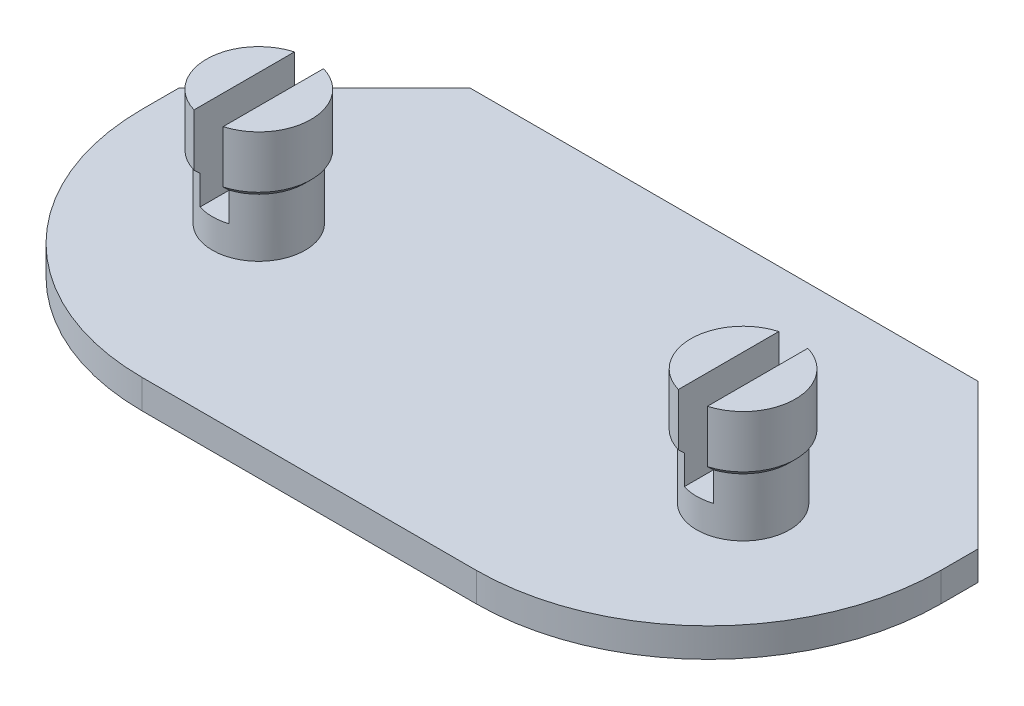
from build123d import *

# Parameters (mm, degrees)
SKETCH2_W               = 55
SKETCH2_H               = 38
BOSS_EXTRUDE1_DEPTH     = 2
SKETCH3_R               = 3.2
BOSS_EXTRUDE2_DEPTH     = 10
SKETCH4_R               = 3.6
BOSS_EXTRUDE3_DEPTH     = 1
CHAMFER1_SIZE           = 3
SKETCH5_W               = 2
SKETCH5_H               = 10.684354826
CUT_EXTRUDE1_DEPTH      = 6
CHAMFER2_SIZE           = 10
CUT_EXTRUDE2_DEPTH      = 35.889110049
CUT_EXTRUDE2_DEPTH_BACK = 35.889110049
SKETCH8_W               = 9.45
SKETCH8_H               = 2
FILLET2_R               = 16


with BuildPart() as part:
    # Sketch2 → Boss-Extrude1 (new body)
    with BuildSketch(Plane(origin=(0, 0, 0), x_dir=(1, 0, 0), z_dir=(0, 1, 0))):
        Rectangle(SKETCH2_W, SKETCH2_H)
    extrude(amount=BOSS_EXTRUDE1_DEPTH)

    # Sketch3 → Boss-Extrude2 (add)
    with BuildSketch(Plane(origin=(0, 0, 0), x_dir=(1, 0, 0), z_dir=(0, 1, 0))):
        with Locations(Location((-16.675, 3.65, 0), (0, 0, 270))):
            Circle(SKETCH3_R)
        with Locations(Location((16.675, 3.65, 0), (0, 0, 90))):
            Circle(SKETCH3_R)
    extrude(amount=BOSS_EXTRUDE2_DEPTH)

    # Sketch4 → Boss-Extrude3 (add)
    with BuildSketch(Plane(origin=(0, 10, 0), x_dir=(1, 0, 0), z_dir=(0, 1, 0))):
        with Locations(Location((-16.675, 3.65, 0), (0, 0, 270))):
            Circle(SKETCH4_R)
        with Locations(Location((16.675, 3.65, 0), (0, 0, 90))):
            Circle(SKETCH4_R)
    extrude(amount=-BOSS_EXTRUDE3_DEPTH)

    # Chamfer1
    # the kernel refuses this chamfer: 3 mm, written as the material it adds along each edge
    with BuildSketch(Plane(origin=(16.675, 9, -3.65), x_dir=(0, 0, -1), z_dir=(-1, 0, 0))) as chamfer1_piece_1_section:
        Polygon((3.2, CHAMFER1_SIZE), (3.2 + CHAMFER1_SIZE, 0), (3.2, 0), align=None)
    chamfer1_piece_1 = revolve(axis=Axis((16.675, 9, -3.65), (0, -1, 0)), mode=Mode.PRIVATE)
    chamfer1_piece_1 = chamfer1_piece_1 & Plane(origin=(16.675, 6.179265151, -3.65), x_dir=(0, 0, -1), z_dir=(0, 1, 0)) * Cylinder(3.6, 25, mode=Mode.PRIVATE)
    add(chamfer1_piece_1)
    with BuildSketch(Plane(origin=(-16.675, 9, -3.65), x_dir=(0, 0, 1), z_dir=(1, 0, 0))) as chamfer1_piece_2_section:
        Polygon((3.2, CHAMFER1_SIZE), (3.2 + CHAMFER1_SIZE, 0), (3.2, 0), align=None)
    chamfer1_piece_2 = revolve(axis=Axis((-16.675, 9, -3.65), (0, -1, 0)), mode=Mode.PRIVATE)
    chamfer1_piece_2 = chamfer1_piece_2 & Plane(origin=(-16.675, 6.179265151, -3.65), x_dir=(0, 0, 1), z_dir=(0, 1, 0)) * Cylinder(3.6, 25, mode=Mode.PRIVATE)
    add(chamfer1_piece_2)

    # Sketch5 → Cut-Extrude1 (cut)
    with BuildSketch(Plane(origin=(0, 10, 0), x_dir=(1, 0, 0), z_dir=(0, 1, 0))):
        with Locations((16.675, 3.65)):
            Rectangle(SKETCH5_W, SKETCH5_H)
        with Locations((-16.675, 3.65)):
            Rectangle(SKETCH5_W, SKETCH5_H)
    extrude(amount=-CUT_EXTRUDE1_DEPTH, mode=Mode.SUBTRACT)

    # Chamfer2
    chamfer2_edges = [part.edges().sort_by_distance(p)[0] for p in [
        (-27.5, 1, -19),
        (27.5, 1, -19),
    ]]
    chamfer(chamfer2_edges, length=CHAMFER2_SIZE)

    # Sketch8 → Cut-Extrude2 (cut, two sides: drawn at the far end of the back side and taken through both)
    with BuildSketch(Plane.ZY.offset(-CUT_EXTRUDE2_DEPTH_BACK)):
        with Locations((14.275, 1)):
            Rectangle(SKETCH8_W, SKETCH8_H)
    extrude(amount=CUT_EXTRUDE2_DEPTH + CUT_EXTRUDE2_DEPTH_BACK, mode=Mode.SUBTRACT)

    # Fillet2
    fillet2_edges = [part.edges().sort_by_distance(p)[0] for p in [
        (27.5, 1, 9.55),
        (-27.5, 1, 9.55),
    ]]
    fillet(fillet2_edges, radius=FILLET2_R)


solid = part.part
